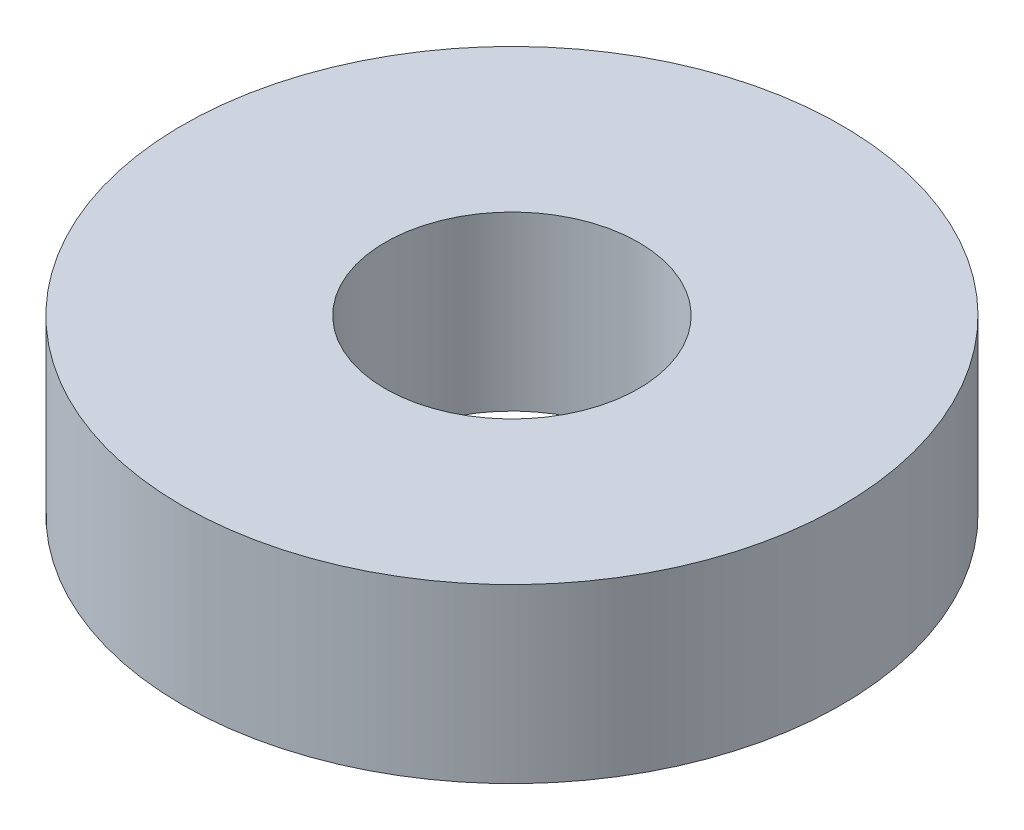
from build123d import *

# Parameters (mm, degrees)
SKETCH1_R           = 32.5
BOSS_EXTRUDE1_DEPTH = 17
SKETCH2_R           = 12.5
CUT_EXTRUDE1_DEPTH  = 50.005101775


with BuildPart() as part:
    # Sketch1 → Boss-Extrude1 (new body)
    with BuildSketch(Plane(origin=(0, 0, 0), x_dir=(1, 0, 0), z_dir=(0, 1, 0))):
        Circle(SKETCH1_R)
    extrude(amount=BOSS_EXTRUDE1_DEPTH)

    # Sketch2 → Cut-Extrude1 (cut, through all)
    with BuildSketch(Plane(origin=(0, 0, 0), x_dir=(1, 0, 0), z_dir=(0, 1, 0))):
        Circle(SKETCH2_R)
    extrude(amount=CUT_EXTRUDE1_DEPTH, mode=Mode.SUBTRACT)


solid = part.part
